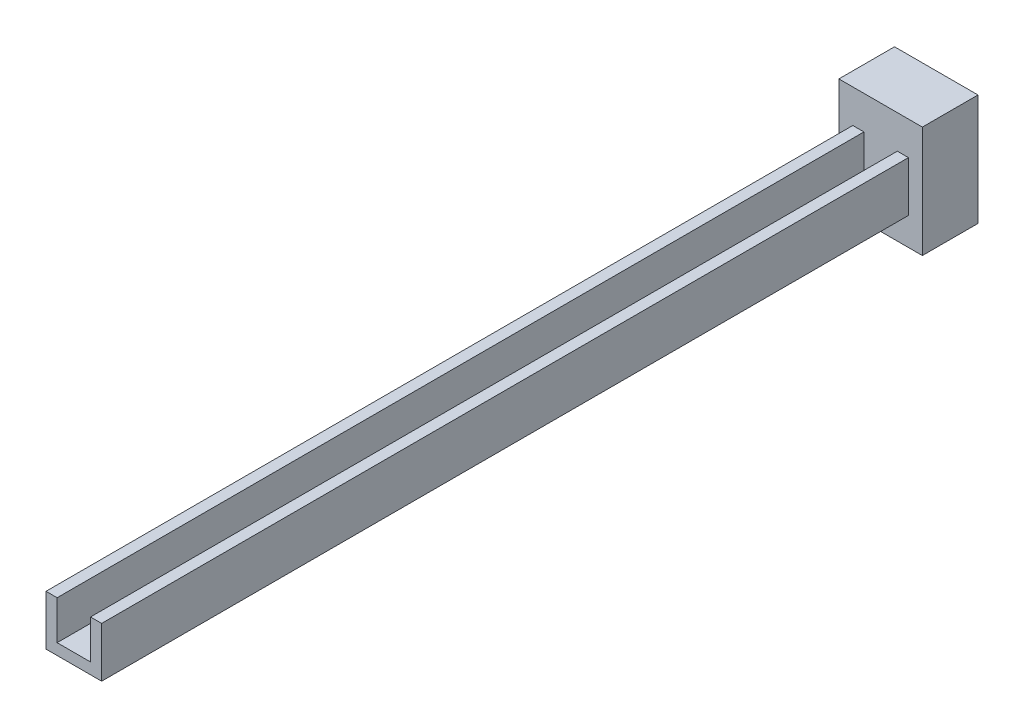
from build123d import *

# Parameters (mm, degrees)
EXTRUDE_1_DEPTH          = 245
SKETCH_2_R               = 2.5
CUT_EXTRUDE_1_DEPTH      = 246.21623111
CUT_EXTRUDE_2_DEPTH      = 246.21623111
CUT_EXTRUDE_2_DEPTH_BACK = 246.21623111
SKETCH_3_W               = 10
SKETCH_3_H               = 100
SKETCH_5_W               = 15
SKETCH_5_H               = 20
EXTRUDE_3_DEPTH          = 10


with BuildPart() as part:
    # ｽｹｯﾁ1 → ﾎﾞｽ - 押し出し1 (new body)
    with BuildSketch(Plane.XY):
        Polygon((-5, 9), (-5, 0), (5, 0), (5, 9), (3, 9), (3, 2), (-3, 2), (-3, 9), align=None)
    extrude(amount=EXTRUDE_1_DEPTH)

    # ｽｹｯﾁ2 → ｶｯﾄ - 押し出し1 (cut, through all)
    with BuildSketch(Plane.XZ):
        with Locations((0, 225)):
            Circle(SKETCH_2_R)
        with Locations((0, 217)):
            Circle(SKETCH_2_R)
        with Locations((0, 122.5)):
            Circle(SKETCH_2_R)
        with Locations((0, 209)):
            Circle(SKETCH_2_R)
        with Locations((0, 193)):
            Circle(SKETCH_2_R)
        with Locations((0, 161)):
            Circle(SKETCH_2_R)
    cut_extrude_1 = extrude(amount=-CUT_EXTRUDE_1_DEPTH, mode=Mode.SUBTRACT)

    # ﾐﾗｰ1: ｶｯﾄ - 押し出し1 across plane
    add(cut_extrude_1.mirror(Plane.XY.offset(122.5)), mode=Mode.SUBTRACT)

    # ｽｹｯﾁ3 → ｶｯﾄ - 押し出し2 (cut, two sides: drawn at the far end of the back side and taken through both)
    with BuildSketch(Plane.XZ.offset(-CUT_EXTRUDE_2_DEPTH_BACK)):
        with Locations((0, 50)):
            Rectangle(SKETCH_3_W, SKETCH_3_H)
    extrude(amount=CUT_EXTRUDE_2_DEPTH + CUT_EXTRUDE_2_DEPTH_BACK, mode=Mode.SUBTRACT)

    # ｽｹｯﾁ5 → ﾎﾞｽ - 押し出し3 (add)
    with BuildSketch(Plane(origin=(0, 0, 100), x_dir=(-1, 0, 0), z_dir=(0, 0, -1))):
        with Locations((0, 5)):
            Rectangle(SKETCH_5_W, SKETCH_5_H)
    extrude(amount=EXTRUDE_3_DEPTH)


solid = part.part
